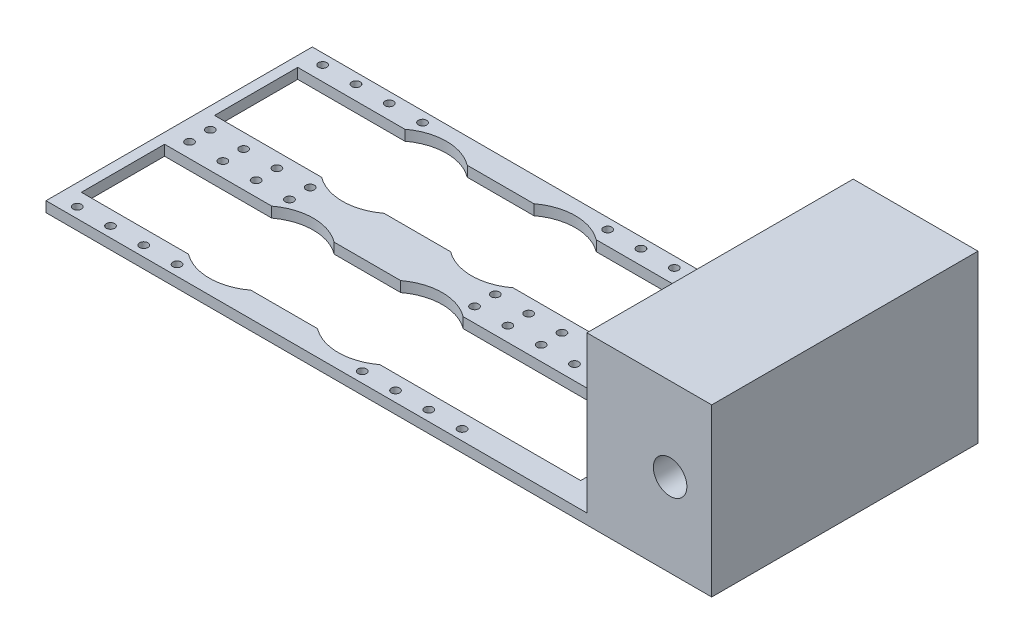
from build123d import *

# Parameters (mm, degrees)
SKETCH1_W           = 160
SKETCH1_H           = 64
BOSS_EXTRUDE1_DEPTH = 40
SKETCH2_R           = 4.025
SKETCH2_W           = 130
SKETCH2_H           = 37.5
CUT_EXTRUDE1_DEPTH  = 110.981816679
SKETCH3_R           = 1
SKETCH3_W           = 120
SKETCH3_H           = 20
CUT_EXTRUDE2_DEPTH  = 95.994736696
SKETCH4_R           = 12.5
CUT_EXTRUDE3_DEPTH  = 94.969409916


with BuildPart() as part:
    # Sketch1 → Boss-Extrude1 (new body)
    with BuildSketch(Plane(origin=(0, 0, 0), x_dir=(1, 0, 0), z_dir=(0, 1, 0))):
        Rectangle(SKETCH1_W, SKETCH1_H)
    extrude(amount=BOSS_EXTRUDE1_DEPTH)

    # Sketch2 → Cut-Extrude1 (cut, through all)
    with BuildSketch(Plane.XY.offset(32)):
        with Locations((70, 20)):
            Circle(SKETCH2_R)
        with Locations((-15, 21.25)):
            Rectangle(SKETCH2_W, SKETCH2_H)
    extrude(amount=-CUT_EXTRUDE1_DEPTH, mode=Mode.SUBTRACT)

    # Sketch3 → Cut-Extrude2 (cut, through all)
    with BuildSketch(Plane(origin=(0, 40, 0), x_dir=(1, 0, 0), z_dir=(0, 1, 0))):
        with Locations((-75, 29.5)):
            Circle(SKETCH3_R)
        with Locations((-75, 2.5)):
            Circle(SKETCH3_R)
        with Locations((-67, 29.5)):
            Circle(SKETCH3_R)
        with Locations((-59, 29.5)):
            Circle(SKETCH3_R)
        with Locations((-51, 29.5)):
            Circle(SKETCH3_R)
        with Locations((-67, 2.5)):
            Circle(SKETCH3_R)
        with Locations((-59, 2.5)):
            Circle(SKETCH3_R)
        with Locations((-51, 2.5)):
            Circle(SKETCH3_R)
        with Locations((-6.5, 29.5)):
            Circle(SKETCH3_R)
        with Locations((-6.5, 2.5)):
            Circle(SKETCH3_R)
        with Locations((1.5, 29.5)):
            Circle(SKETCH3_R)
        with Locations((9.5, 29.5)):
            Circle(SKETCH3_R)
        with Locations((17.5, 29.5)):
            Circle(SKETCH3_R)
        with Locations((1.5, 2.5)):
            Circle(SKETCH3_R)
        with Locations((9.5, 2.5)):
            Circle(SKETCH3_R)
        with Locations((17.5, 2.5)):
            Circle(SKETCH3_R)
        with Locations((17.5, -2.5)):
            Circle(SKETCH3_R)
        with Locations((9.5, -2.5)):
            Circle(SKETCH3_R)
        with Locations((1.5, -2.5)):
            Circle(SKETCH3_R)
        with Locations((17.5, -29.5)):
            Circle(SKETCH3_R)
        with Locations((9.5, -29.5)):
            Circle(SKETCH3_R)
        with Locations((1.5, -29.5)):
            Circle(SKETCH3_R)
        with Locations((-6.5, -2.5)):
            Circle(SKETCH3_R)
        with Locations((-6.5, -29.5)):
            Circle(SKETCH3_R)
        with Locations((-51, -2.5)):
            Circle(SKETCH3_R)
        with Locations((-59, -2.5)):
            Circle(SKETCH3_R)
        with Locations((-67, -2.5)):
            Circle(SKETCH3_R)
        with Locations((-51, -29.5)):
            Circle(SKETCH3_R)
        with Locations((-59, -29.5)):
            Circle(SKETCH3_R)
        with Locations((-67, -29.5)):
            Circle(SKETCH3_R)
        with Locations((-75, -2.5)):
            Circle(SKETCH3_R)
        with Locations((-75, -29.5)):
            Circle(SKETCH3_R)
        with Locations((-17.5, 16)):
            Rectangle(SKETCH3_W, SKETCH3_H)
        with Locations((-17.5, -16)):
            Rectangle(SKETCH3_W, SKETCH3_H)
    extrude(amount=-CUT_EXTRUDE2_DEPTH, mode=Mode.SUBTRACT)

    # Sketch4 → Cut-Extrude3 (cut, through all)
    with BuildSketch(Plane(origin=(0, 2.5, 0), x_dir=(1, 0, 0), z_dir=(0, 1, 0))):
        with Locations((-44.25, -16)):
            Circle(SKETCH4_R)
        with Locations((-44.25, 16)):
            Circle(SKETCH4_R)
        with Locations((-13.25, 16)):
            Circle(SKETCH4_R)
        with Locations((-13.25, -16)):
            Circle(SKETCH4_R)
    extrude(amount=-CUT_EXTRUDE3_DEPTH, mode=Mode.SUBTRACT)


solid = part.part
